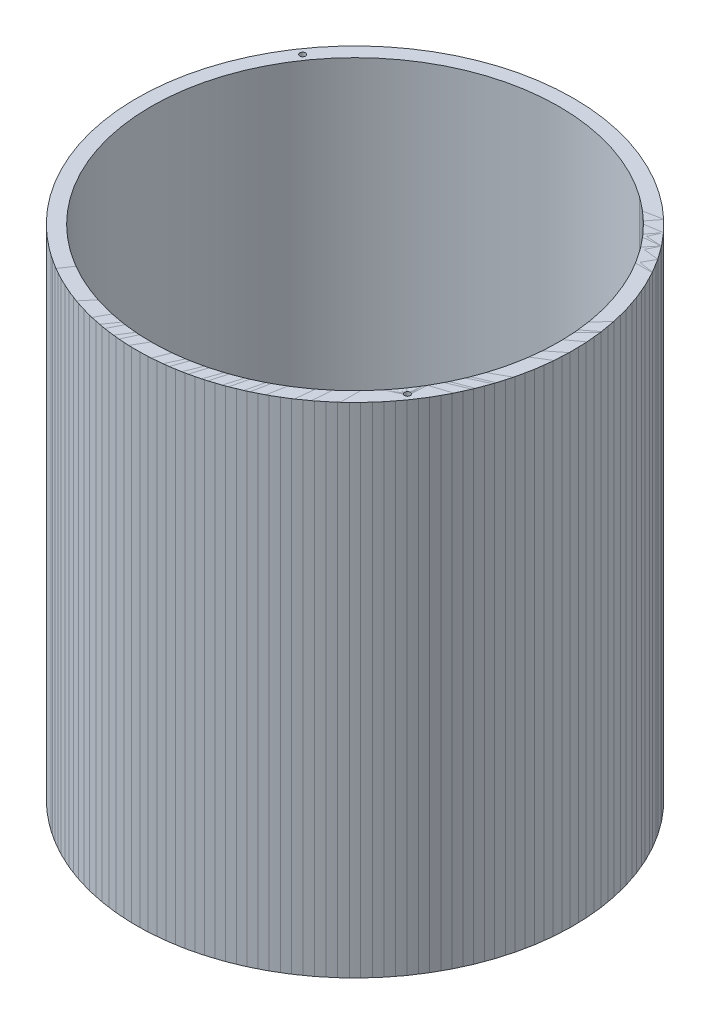
from build123d import *

# Parameters (mm, degrees)
SKETCH2_R                   = 1
BOSS_EXTRUDE1_DEPTH         = 173.5
BODY_MOVE_COPY2_START       = 151.289542195
BODY_MOVE_COPY2_OUTLINE_R   = 76
BODY_MOVE_COPY2_OUTLINE_R_2 = 1
BODY_MOVE_COPY2_OUTLINE_R_3 = 71
BODY_MOVE_COPY2_DEPTH       = 173.5
SKETCH9_W                   = 216.594473319
SKETCH9_H                   = 193.225251402
CUT_EXTRUDE2_DEPTH          = 759.638053814


# Read off the part's stored shape, not the designer's step: Body-Move/Copy2
with BuildPart() as part:
    # Sketch2 → Boss-Extrude1 (new body)
    with BuildSketch(Plane.XZ.offset(-151.289542195)):
        with BuildLine():
            ThreePointArc((255.728497138, 884.910071306), (149.915934679, 903.770125014), (131.055880971, 797.957562555))
            ThreePointArc((131.055880971, 797.957562555), (236.86844343, 779.097508847), (255.728497138, 884.910071306))
        make_face()
        with BuildLine():
            ThreePointArc((134.106417421, 799.387702501), (133.406238551, 798.433707066), (132.286202841, 798.815646523))
            ThreePointArc((132.286202841, 798.815646523), (132.534361442, 800.207917082), (133.926632001, 799.95975848))
            ThreePointArc((133.926632001, 799.95975848), (134.060412856, 799.687523631), (134.106417421, 799.387702501))
        make_face(mode=Mode.SUBTRACT)
        with BuildLine():
            ThreePointArc((251.627424238, 882.049791413), (234.008163537, 783.198581747), (135.156953871, 800.817842448))
            ThreePointArc((135.156953871, 800.817842448), (152.776214572, 899.669052114), (251.627424238, 882.049791413))
        make_face(mode=Mode.SUBTRACT)
        with Locations(Location((253.677960688, 883.479931359, 0), (0, 0, 270))):
            Circle(SKETCH2_R, mode=Mode.SUBTRACT)
    extrude(amount=-BOSS_EXTRUDE1_DEPTH)


with BuildPart() as body_2:
    # Body-Move/Copy2 outline → Body-Move/Copy2 (new body)
    with BuildSketch(Plane(origin=(0, 0, 0), x_dir=(1, 0, 0), z_dir=(0, 1, 0)).offset(BODY_MOVE_COPY2_START)):
        with Locations((193.392189054, -841.43381693)):
            Circle(BODY_MOVE_COPY2_OUTLINE_R)
        with Locations((253.677960688, -883.479931359)):
            Circle(BODY_MOVE_COPY2_OUTLINE_R_2, mode=Mode.SUBTRACT)
        with Locations((133.106417421, -799.387702501)):
            Circle(BODY_MOVE_COPY2_OUTLINE_R_2, mode=Mode.SUBTRACT)
        with Locations((193.392189054, -841.43381693)):
            Circle(BODY_MOVE_COPY2_OUTLINE_R_3, mode=Mode.SUBTRACT)
    extrude(amount=BODY_MOVE_COPY2_DEPTH)

    # Sketch9 → Cut-Extrude2 (cut, through all)
    with BuildSketch(Plane(origin=(524.913002616, 0, 366.098858407), x_dir=(0.5720559786237354, 0, -0.8202145800464904), z_dir=(0.8202145800464904, 0, 0.5720559786237354))):
        with Locations((-576.198099642, 233.376121689)):
            Rectangle(SKETCH9_W, SKETCH9_H)
    extrude(amount=-CUT_EXTRUDE2_DEPTH, mode=Mode.SUBTRACT)


solid = Compound([part.part, body_2.part])
